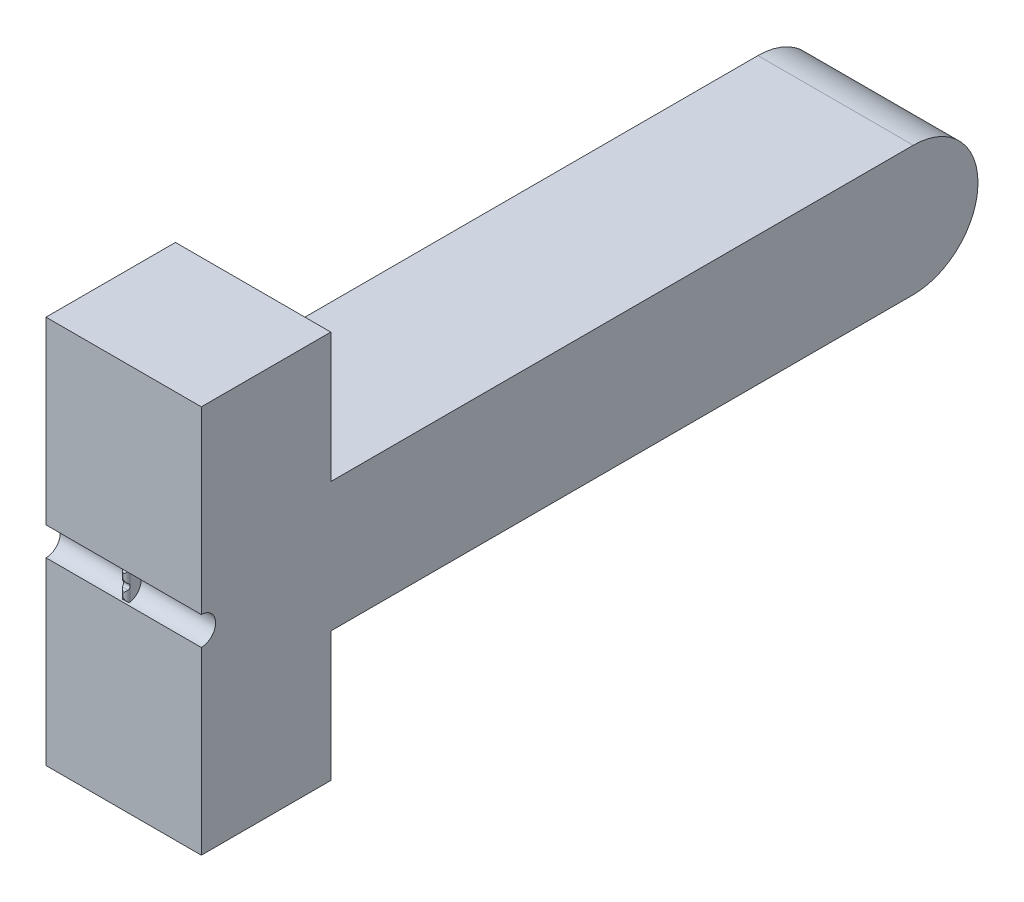
from build123d import *

# Parameters (mm, degrees)
SKETCH_1_W          = 12
SKETCH_1_H          = 10
EXTRUDE_1_DEPTH     = 60
CUT_EXTRUDE_3_DEPTH = 60
EXTRUDE_2_DEPTH     = 12
SKETCH_4_R          = 1.1
CUT_EXTRUDE_4_DEPTH = 12
EXTRUDE_3_DEPTH     = 0.25
SKETCH_6_R          = 0.25
CUT_EXTRUDE_5_DEPTH = 1.5
FILLET_1_R          = 0.25


with BuildPart() as part:
    # 草图1 → 凸台-拉伸1 (new body)
    with BuildSketch(Plane.XY):
        with Locations((-6, 5)):
            Rectangle(SKETCH_1_W, SKETCH_1_H)
    extrude(amount=EXTRUDE_1_DEPTH)

    # 草图2 → 切除-拉伸3 (cut)
    with BuildSketch(Plane.ZY.offset(12)):
        with BuildLine():
            ThreePointArc((0, 5), (1.464466094, 8.535533906), (5, 10))
            Line((5, 10), (0, 10))
            Line((0, 10), (0, 5))
        make_face()
        with BuildLine():
            ThreePointArc((5, 0), (1.464466094, 1.464466094), (0, 5))
            Line((0, 5), (0, 0))
            Line((0, 0), (5, 0))
        make_face()
    extrude(amount=-CUT_EXTRUDE_3_DEPTH, mode=Mode.SUBTRACT)

    # 草图3 → 凸台-拉伸2 (add)
    with BuildSketch(Plane.ZY.offset(12)):
        Polygon((60, 5), (60, 20), (50, 20), (50, -10), (60, -10), align=None)
    extrude(amount=-EXTRUDE_2_DEPTH)

    # 草图4 → 切除-拉伸4 (cut)
    with BuildSketch(Plane.ZY.offset(12)):
        with Locations((60, 5)):
            Circle(SKETCH_4_R)
    extrude(amount=-CUT_EXTRUDE_4_DEPTH, mode=Mode.SUBTRACT)


with BuildPart() as body_2:
    # 草图5 → 凸台-拉伸3 (new, symmetric)
    with BuildSketch(Plane(origin=(-6, 0, 0), x_dir=(0, 0, -1), z_dir=(1, 0, 0))):
        with BuildLine():
            Line((-60, 3.9), (-60, 4.75))
            Line((-60, 4.75), (-60, 5.25))
            Line((-60, 5.25), (-60, 6.1))
            ThreePointArc((-60, 6.1), (-58.9, 5), (-60, 3.9))
        make_face()
    extrude(amount=EXTRUDE_3_DEPTH, both=True)

    # 草图6 → 切除-拉伸5 (cut, symmetric)
    with BuildSketch(Plane(origin=(-6, 0, 0), x_dir=(0, 0, -1), z_dir=(1, 0, 0))):
        with Locations((-60, 5)):
            Circle(SKETCH_6_R)
    extrude(amount=CUT_EXTRUDE_5_DEPTH, both=True, mode=Mode.SUBTRACT)

    # 圆角1
    fillet_1_edges = [body_2.edges().sort_by_distance(p)[0] for p in [
        (-6.25, 4.325, 60),
        (-6.25, 5.675, 60),
        (-6, 6.1, 60),
        (-6, 3.9, 60),
        (-5.75, 4.325, 60),
        (-5.75, 5.675, 60),
        (-6, 5.25, 60),
        (-6, 4.75, 60),
    ]]
    fillet(fillet_1_edges, radius=FILLET_1_R - 0.0001)  # a hair under: the kernel refuses the full size


solid = Compound([part.part, body_2.part])
